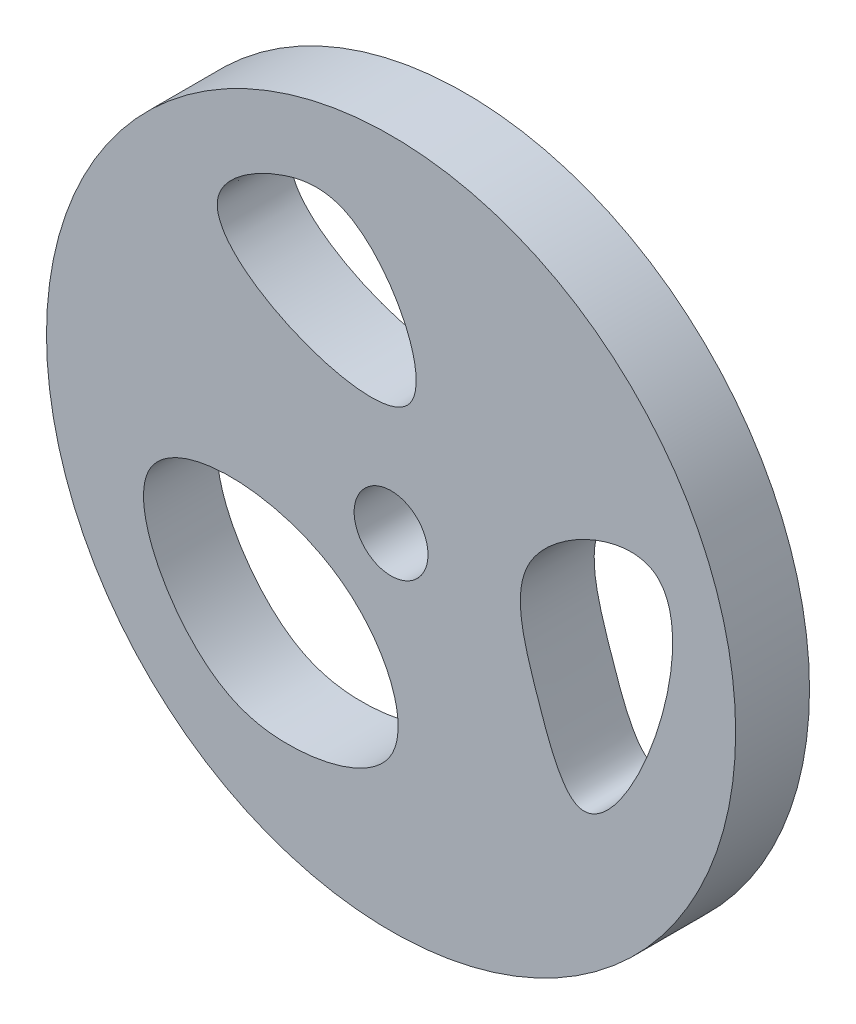
from build123d import *

# Parameters (mm, degrees)
CROQUIS4_R              = 28
CROQUIS4_R_2            = 3
SALIENTE_EXTRUIR4_DEPTH = 6
ESCALA1_OUTLINE_R       = 3
ESCALA1_DEPTH           = 6
ESCALA1_START           = -17.999496841
ESCALA1_2_OUTLINE_R     = 196
ESCALA1_2_OUTLINE_R_2   = 21
ESCALA1_2_DEPTH         = 42


# Read off the part's stored shape, not the designer's step: Escala1
with BuildPart() as part:
    # Croquis4 → Saliente-Extruir4 (new body)
    with BuildSketch(Plane.XY):
        Circle(CROQUIS4_R)
        Circle(CROQUIS4_R_2, mode=Mode.SUBTRACT)
        with BuildLine():
            add(Edge.make_bspline(
                [(-8.661870504, 20.848920863), (-11.134345794, 20.034136118), (-20.297893872, 14.130888348), (8.217093964, 2.571162502), (-1.30222885, 21.85293415), (-6.958093307, 21.41038721), (-8.661870504, 20.848920863)],
                knots=[0, 0, 0, 0, 0.171198279, 0.582988164, 0.882027649, 1, 1, 1, 1], degree=3))
        make_face(mode=Mode.SUBTRACT)
        with BuildLine():
            add(Edge.make_bspline(
                [(-19.741007194, -5.539568345), (-21.249718651, -8.841074311), (-16.531516182, -17.452719956), (-7.778034095, -19.759488675), (3.221126904, -16.771647645), (-3.062506153, -1.512267892), (-17.915961418, -1.545829524), (-19.741007194, -5.539568345)],
                knots=[0, 0, 0, 0, 0.239927974, 0.343384518, 0.513257855, 0.709765884, 1, 1, 1, 1], degree=3))
        make_face(mode=Mode.SUBTRACT)
        with BuildLine():
            add(Edge.make_bspline(
                [(21.352517986, 7.956834532), (18.964775909, 9.536744657), (8.614824702, 4.736209176), (11.365159497, -4.210520436), (16.807060129, -19.490986174), (25.946827357, 4.916893174), (21.352517986, 7.956834532)],
                knots=[0, 0, 0, 0, 0.224446261, 0.423947928, 0.568137794, 1, 1, 1, 1], degree=3))
        make_face(mode=Mode.SUBTRACT)
    extrude(amount=SALIENTE_EXTRUIR4_DEPTH)

    # Escala1 outline → Escala1 (cut)
    with BuildSketch(Plane.XY):
        with BuildLine():
            add(Edge.make_bspline(
                [(17.000522152, 7.967507439), (14.840589963, 7.215803291), (9.089500341, 3.192108217), (11.365159497, -4.210520436), (14.550664807, -13.155190328), (17.331175474, -11.190725846), (18.484727449, -9.617464952)],
                knots=[0.098053943, 0.098053943, 0.098053943, 0.098053943, 0.224446261, 0.423947928, 0.568137794, 0.678429294, 0.678429294, 0.678429294, 0.678429294], degree=3))
            ThreePointArc((17.000522152, 7.967507439), (9.434064569, 15.653634005), (-0.949635508, 18.57024071))
            add(Edge.make_bspline(
                [(-13.643682988, 14.522281267), (-11.296449172, 10.565883797), (5.297482073, 4.692739999), (1.478494793, 15.764375539), (-0.949635508, 18.57024071)],
                knots=[0.227878432, 0.227878432, 0.227878432, 0.227878432, 0.582988164, 0.803352892, 0.803352892, 0.803352892, 0.803352892], degree=3))
            ThreePointArc((-13.643682988, 14.522281267), (-13.860654258, -19.216764164), (18.484727449, -9.617464952))
        make_face()
        with BuildLine():
            add(Edge.make_bspline(
                [(-19.741007194, -5.539568345), (-21.249718651, -8.841074311), (-16.531516182, -17.452719956), (-7.778034095, -19.759488675), (3.221126904, -16.771647645), (-3.062506153, -1.512267892), (-17.915961418, -1.545829524), (-19.741007194, -5.539568345)],
                knots=[0, 0, 0, 0, 0.239927974, 0.343384518, 0.513257855, 0.709765884, 1, 1, 1, 1], degree=3))
        make_face(mode=Mode.SUBTRACT)
        Circle(ESCALA1_OUTLINE_R, mode=Mode.SUBTRACT)
    extrude(amount=ESCALA1_DEPTH, mode=Mode.SUBTRACT)

    # Escala1 2 outline → Escala1 2 (add)
    with BuildSketch(Plane.XY.offset(ESCALA1_START)):
        with Locations((-1.246131437, -2.427666094)):
            Circle(ESCALA1_2_OUTLINE_R)
        with BuildLine():
            add(Edge.make_bspline(
                [(-139.433181797, -41.204644512), (-149.994161996, -64.315186271), (-116.966744714, -124.596705788), (-55.692370104, -140.74408682), (21.301756893, -119.829199607), (-22.683674511, -13.013541342), (-126.657861367, -13.248472762), (-139.433181797, -41.204644512)],
                knots=[0, 0, 0, 0, 0.239927974, 0.343384518, 0.513257855, 0.709765884, 1, 1, 1, 1], degree=3))
        make_face(mode=Mode.SUBTRACT)
        with BuildLine():
            add(Edge.make_bspline(
                [(148.221494462, 53.270175632), (131.507299926, 64.329546503), (59.057641477, 30.725798138), (78.309985044, -31.901309148), (116.403289469, -138.864569314), (180.381660063, 31.990586127), (148.221494462, 53.270175632)],
                knots=[0, 0, 0, 0, 0.224446261, 0.423947928, 0.568137794, 1, 1, 1, 1], degree=3))
        make_face(mode=Mode.SUBTRACT)
        with BuildLine():
            add(Edge.make_bspline(
                [(-61.879224962, 143.514779949), (-79.186551993, 137.811286735), (-143.331388538, 96.488552344), (56.273526308, 15.570471419), (-10.361733388, 150.542872956), (-49.95278459, 147.445044375), (-61.879224962, 143.514779949)],
                knots=[0, 0, 0, 0, 0.171198279, 0.582988164, 0.882027649, 1, 1, 1, 1], degree=3))
        make_face(mode=Mode.SUBTRACT)
        with Locations((-1.246131437, -2.427666094)):
            Circle(ESCALA1_2_OUTLINE_R_2, mode=Mode.SUBTRACT)
    extrude(amount=ESCALA1_2_DEPTH)


solid = part.part
